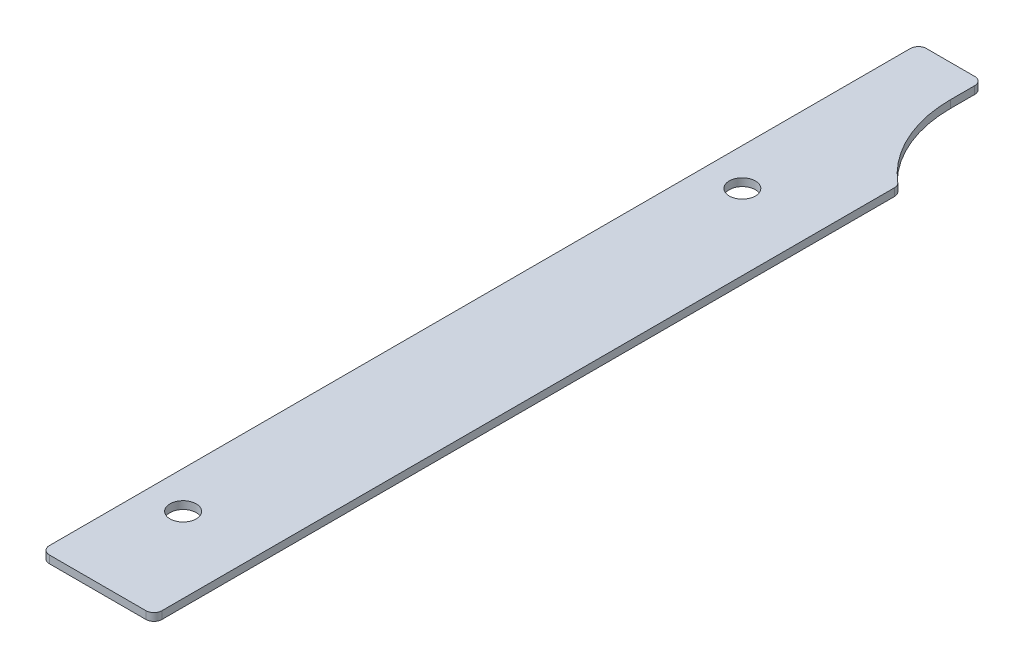
from build123d import *

# Parameters (mm, degrees)
SKETCH1_W          = 44.45
SKETCH1_H          = 346.075
BASE_FLANGE1_DEPTH = 3.0226
CUT_EXTRUDE1_REACH = 176.485
SKETCH6_R          = 5.159375
SKETCH6_W          = 19.05
SKETCH6_H          = 52.3875
FILLET2_R          = 50.8
FILLET3_R          = 3.175


# Sheet-metal steps are written as plain solids
with BuildPart() as part:
    # Sketch1 → Base-Flange1 (new body)
    with BuildSketch(Plane(origin=(0, 0, 0), x_dir=(1, 0, 0), z_dir=(0, 1, 0))):
        Rectangle(SKETCH1_W, SKETCH1_H)
    extrude(amount=-BASE_FLANGE1_DEPTH)

    # Sketch6 → Cut-Extrude1 (cut, up to next)
    with BuildSketch(Plane(origin=(0, 0, 0), x_dir=(1, 0, 0), z_dir=(0, 1, 0)), mode=Mode.PRIVATE) as cut_extrude1_sk1:
        with Locations(Location((-7.540625, -131.7625, 0), (0, 0, 270))):
            Circle(SKETCH6_R)
    cut_extrude1_tool1 = extrude(cut_extrude1_sk1.sketch, amount=-CUT_EXTRUDE1_REACH, mode=Mode.PRIVATE) & part.part
    # Sketch6 → Cut-Extrude1 (cut, up to next)
    with BuildSketch(Plane(origin=(0, 0, 0), x_dir=(1, 0, 0), z_dir=(0, 1, 0)), mode=Mode.PRIVATE) as cut_extrude1_sk2:
        with Locations(Location((-7.540625, 88.9, 0), (0, 0, 270))):
            Circle(SKETCH6_R)
    cut_extrude1_tool2 = extrude(cut_extrude1_sk2.sketch, amount=-CUT_EXTRUDE1_REACH, mode=Mode.PRIVATE) & part.part
    # Sketch6 → Cut-Extrude1 (cut, up to next)
    with BuildSketch(Plane(origin=(0, 0, 0), x_dir=(1, 0, 0), z_dir=(0, 1, 0)), mode=Mode.PRIVATE) as cut_extrude1_sk3:
        with Locations((12.7, 146.84375)):
            Rectangle(SKETCH6_W, SKETCH6_H)
    cut_extrude1_tool3 = extrude(cut_extrude1_sk3.sketch, amount=-CUT_EXTRUDE1_REACH, mode=Mode.PRIVATE) & part.part
    add(cut_extrude1_tool1.solids().sort_by_distance((-7.540625, 0, 131.7625))[0], mode=Mode.SUBTRACT)
    add(cut_extrude1_tool2.solids().sort_by_distance((-7.540625, 0, -88.9))[0], mode=Mode.SUBTRACT)
    add(cut_extrude1_tool3.solids().sort_by_distance((12.7, 0, -146.84375))[0], mode=Mode.SUBTRACT)

    # Fillet2
    # the kernel refuses this fillet: 50.8 mm, written as the material it adds along each edge
    with BuildSketch(Plane(origin=(3.175, 0, -120.65), x_dir=(1, 0, 0), z_dir=(0, -1, 0))) as fillet2_piece_1:
        with BuildLine():
            CenterArc((50.8, -39.65573729), FILLET2_R, 128.682187453, 51.317812547)
            Line((0, -39.65573729), (-1.016, -39.65573729))
            Line((-1.016, -39.65573729), (-1.016, 0))
            Line((-1.016, 0), (0, 1.016))
            ThreePointArc((0, 1.016), (9.525, 1.016), (18.415, 0.793114746))
            Line((18.415, 0.793114746), (19.05, 0))
        make_face()
    extrude(amount=3.0226)

    # Fillet3
    fillet3_edges = [part.edges().sort_by_distance(p)[0] for p in [
        (22.225, -1.5113, -120.65),
        (3.175, -1.5113, -173.0375),
        (-22.225, -1.5113, -173.0375),
        (22.225, -1.5113, 173.0375),
        (-22.225, -1.5113, 173.0375),
    ]]
    fillet(fillet3_edges, radius=FILLET3_R)


solid = part.part
